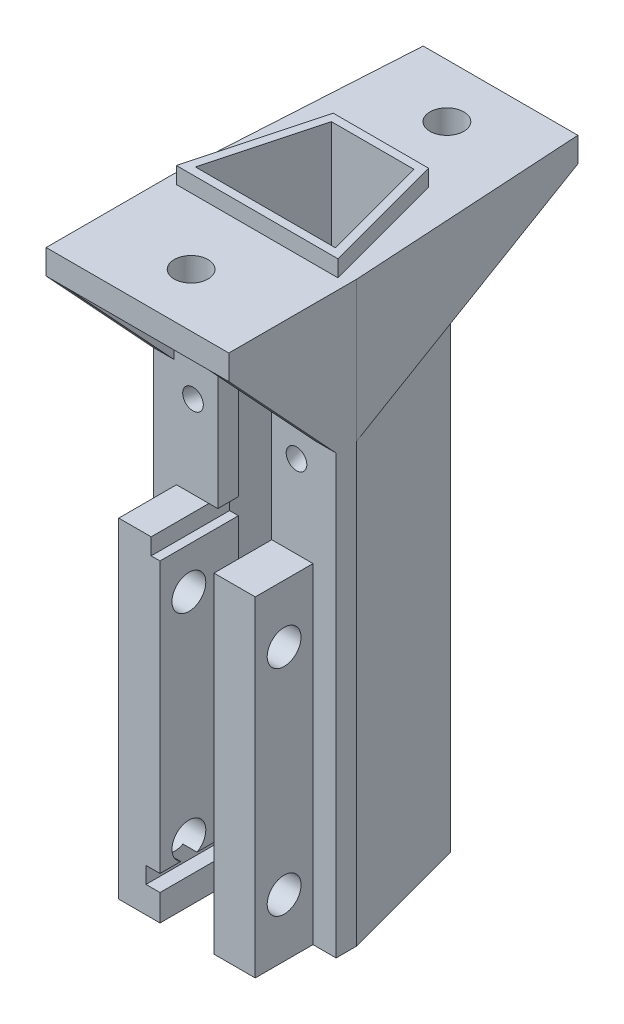
from build123d import *

# Parameters (mm, degrees)
BOSS_EXTRUDE1_DEPTH      = 40
SKETCH3_R                = 2.05
CUT_EXTRUDE2_DEPTH       = 40
BOSS_EXTRUDE2_DEPTH      = 30
SKETCH7_W                = 4.5
SKETCH7_H                = 2
CUT_EXTRUDE3_DEPTH       = 76.328383431
SKETCH8_W                = 1.7
SKETCH8_H                = 2
CUT_EXTRUDE4_DEPTH       = 73.729741855
BOSS_EXTRUDE3_DEPTH      = 2
SKETCH10_W               = 4.5
SKETCH10_H               = 75
CUT_EXTRUDE5_DEPTH       = 1.5
SKETCH13_W               = 2.8
SKETCH13_H               = 2
CUT_EXTRUDE7_DEPTH       = 1.5
SKETCH15_W               = 1.5
SKETCH15_H               = 2
CUT_EXTRUDE8_DEPTH       = 18.5
SKETCH16_R               = 1.25
CUT_EXTRUDE9_DEPTH       = 3.5
SKETCH17_R               = 1.25
CUT_EXTRUDE10_DEPTH      = 3.5
SKETCH18_W               = 22.143059906
SKETCH18_H               = 3
BOSS_EXTRUDE4_DEPTH      = 15.5
BOSS_EXTRUDE5_DEPTH      = 13
BOSS_EXTRUDE5_DEPTH_BACK = 2
SKETCH19_W               = 13.83663494
SKETCH19_H               = 3
BOSS_EXTRUDE6_DEPTH      = 2.5
BOSS_EXTRUDE8_DEPTH      = 2.5
BOSS_EXTRUDE9_DEPTH      = 4.2
BOSS_EXTRUDE10_DEPTH     = 4.2
SKETCH25_R               = 2.05
CUT_EXTRUDE12_DEPTH      = 3.5
CUT_EXTRUDE13_DEPTH      = 71.528016285
CUT_EXTRUDE14_DEPTH      = 71.528016285


with BuildPart() as part:
    # Sketch2 → Boss-Extrude1 (new body)
    with BuildSketch(Plane(origin=(0, 0, 0), x_dir=(1, 0, 0), z_dir=(0, 1, 0))):
        Polygon((5.768335638, 3.843580014), (-8.068299302, 3.843580014), (-12.221511785, -11.656419986), (-12.221511785, -14.156419986), (-9.421511785, -14.156419986), (-9.421511785, -21.156419986), (-4.421511785, -21.156419986), (-4.421511785, -11.656419986), (-9.633321334, -11.656419986), (-6.149981832, 1.343580014), (3.850018168, 1.343580014), (7.33335767, -11.656419986), (2.121548121, -11.656419986), (2.121548121, -21.156419986), (7.121548121, -21.156419986), (7.121548121, -14.156419986), (9.921548121, -14.156419986), (9.921548121, -11.656419986), align=None)
    extrude(amount=BOSS_EXTRUDE1_DEPTH)

    # Sketch3 → Cut-Extrude2 (cut)
    with BuildSketch(Plane.ZY.offset(9.421511785)):
        with Locations((17.656419986, 33)):
            Circle(SKETCH3_R)
        with Locations((17.656419986, 7)):
            Circle(SKETCH3_R)
    extrude(amount=-CUT_EXTRUDE2_DEPTH, mode=Mode.SUBTRACT)

    # Sketch4 → Boss-Extrude2 (add)
    with BuildSketch(Plane(origin=(0, 40, 0), x_dir=(1, 0, 0), z_dir=(0, 1, 0))):
        Polygon((-4.421511785, -11.656419986), (-9.633321334, -11.656419986), (-6.149981832, 1.343580014), (3.850018168, 1.343580014), (7.33335767, -11.656419986), (2.121548121, -11.656419986), (2.121548121, -14.156419986), (7.121548121, -14.156419986), (9.921548121, -14.156419986), (9.921548121, -11.656419986), (5.768335638, 3.843580014), (-8.068299302, 3.843580014), (-12.221511785, -11.656419986), (-12.221511785, -14.156419986), (-9.421511785, -14.156419986), (-4.421511785, -14.156419986), align=None)
    extrude(amount=BOSS_EXTRUDE2_DEPTH)

    # Sketch7 → Cut-Extrude3 (cut, through all)
    with BuildSketch(Plane(origin=(0, 0, -3.843580014), x_dir=(-1, 0, 0), z_dir=(0, 0, -1))):
        with Locations((3.241664362, 39)):
            Rectangle(SKETCH7_W, SKETCH7_H)
    extrude(amount=-CUT_EXTRUDE3_DEPTH, mode=Mode.SUBTRACT)

    # Sketch8 → Cut-Extrude4 (cut, through all)
    with BuildSketch(Plane(origin=(0, 0, 11.656419986), x_dir=(-1, 0, 0), z_dir=(0, 0, -1))):
        with Locations((5.271511785, 4.2)):
            Rectangle(SKETCH8_W, SKETCH8_H)
    extrude(amount=-CUT_EXTRUDE4_DEPTH, mode=Mode.SUBTRACT)

    # Sketch9 → Boss-Extrude3 (add)
    with BuildSketch(Plane(origin=(0, 70, 0), x_dir=(1, 0, 0), z_dir=(0, 1, 0))):
        Polygon((-10.936546706, -12.656419986), (8.636583042, -12.656419986), (4.617345156, 2.343580014), (-6.91730882, 2.343580014), align=None)
        Polygon((7.33335767, -11.656419986), (-9.633321334, -11.656419986), (-6.149981832, 1.343580014), (3.850018168, 1.343580014), align=None, mode=Mode.SUBTRACT)
    extrude(amount=BOSS_EXTRUDE3_DEPTH)

    # Sketch10 → Cut-Extrude5 (cut)
    with BuildSketch(Plane(origin=(0, 0, -3.843580014), x_dir=(-1, 0, 0), z_dir=(0, 0, -1))):
        with Locations((3.241664362, 77.5)):
            Rectangle(SKETCH10_W, SKETCH10_H)
    extrude(amount=-CUT_EXTRUDE5_DEPTH, mode=Mode.SUBTRACT)

    # Sketch13 → Cut-Extrude7 (cut)
    with BuildSketch(Plane(origin=(0, 0, -2.343580014), x_dir=(-1, 0, 0), z_dir=(0, 0, -1))):
        with Locations((6.891664362, 41)):
            Rectangle(SKETCH13_W, SKETCH13_H)
    extrude(amount=CUT_EXTRUDE7_DEPTH, mode=Mode.SUBTRACT)

    # Sketch15 → Cut-Extrude8 (cut, along a direction that is not the sketch's normal)
    with BuildSketch(Plane(origin=(0, 0, -3.843580014), x_dir=(-1, 0, 0), z_dir=(0, 0, -1))):
        with Locations((7.318299302, 41)):
            Rectangle(SKETCH15_W, SKETCH15_H)
    extrude(amount=-CUT_EXTRUDE8_DEPTH, dir=(0.25881904510252474, 0, -0.9659258262890672), mode=Mode.SUBTRACT)

    # Sketch16 → Cut-Extrude9 (cut, along a direction that is not the sketch's normal)
    with BuildSketch(Plane.XY.offset(14.156419986)):
        with Locations((-7.421511785, 50)):
            Circle(SKETCH16_R)
    extrude(amount=-CUT_EXTRUDE9_DEPTH, dir=(-0.2588190451025246, 0, 0.9659258262890672), mode=Mode.SUBTRACT)

    # Sketch17 → Cut-Extrude10 (cut, along a direction that is not the sketch's normal)
    with BuildSketch(Plane.XY.offset(14.156419986)):
        with Locations((5.121548121, 50)):
            Circle(SKETCH17_R)
    extrude(amount=-CUT_EXTRUDE10_DEPTH, dir=(0.25881904510251796, 0, 0.9659258262890691), mode=Mode.SUBTRACT)

    # Sketch18 → Boss-Extrude4 (add)
    with BuildSketch(Plane(origin=(0, 0, 11.656419986), x_dir=(-1, 0, 0), z_dir=(0, 0, -1))):
        with Locations((1.149981832, 68.5)):
            Rectangle(SKETCH18_W, SKETCH18_H)
    extrude(amount=-BOSS_EXTRUDE4_DEPTH)

    # Sketch19 → Boss-Extrude5 (add, two sides: drawn at the far end of the back side and taken through both)
    with BuildSketch(Plane(origin=(0, 0, -3.843580014), x_dir=(-1, 0, 0), z_dir=(0, 0, -1)).offset(-BOSS_EXTRUDE5_DEPTH_BACK)):
        with Locations((1.149981832, 68.5)):
            Rectangle(SKETCH19_W, SKETCH19_H)
    extrude(amount=BOSS_EXTRUDE5_DEPTH + BOSS_EXTRUDE5_DEPTH_BACK)

    # Sketch21 → Boss-Extrude6 (add)
    with BuildSketch(Plane.ZY.offset(12.221511785)):
        Polygon((27.156419986, 67), (14.156419986, 53), (14.156419986, 67), align=None)
    extrude(amount=-BOSS_EXTRUDE6_DEPTH)

    # Sketch22 → Boss-Extrude8 (add)
    with BuildSketch(Plane(origin=(9.921548121, 0, 0), x_dir=(0, 0, -1), z_dir=(1, 0, 0))):
        Polygon((-27.156419986, 67), (-14.156419986, 67), (-14.156419986, 53), align=None)
    extrude(amount=-BOSS_EXTRUDE8_DEPTH)

    # Sketch23 → Boss-Extrude9 (add)
    with BuildSketch(Plane(origin=(9.921548121, 0, 0), x_dir=(0, 0, -1), z_dir=(1, 0, 0))):
        Polygon((-11.656419986, 70), (-11.656419986, 53), (16.843580014, 67), (16.843580014, 70), align=None)
    extrude(amount=-BOSS_EXTRUDE9_DEPTH)

    # Sketch24 → Boss-Extrude10 (add)
    with BuildSketch(Plane.ZY.offset(12.221511785)):
        Polygon((11.656419986, 70), (-16.843580014, 70), (-16.843580014, 67), (11.656419986, 53), align=None)
    extrude(amount=-BOSS_EXTRUDE10_DEPTH)

    # Sketch25 → Cut-Extrude12 (cut)
    with BuildSketch(Plane(origin=(0, 70, 0), x_dir=(1, 0, 0), z_dir=(0, 1, 0))):
        with Locations((-1.149981694, 10.343580014)):
            Circle(SKETCH25_R)
        with Locations((-1.149981723, -20.656419986)):
            Circle(SKETCH25_R)
    extrude(amount=-CUT_EXTRUDE12_DEPTH, mode=Mode.SUBTRACT)

    # Sketch26 → Cut-Extrude13 (cut, through all, along a direction that is not the sketch's normal)
    with BuildSketch(Plane(origin=(0, 47.309855268, 23.239928904), x_dir=(-1, 0, 0), z_dir=(-4.742047126241555e-14, -0.8975543264374147, -0.4409038796534669))):
        Polygon((-5.721548121, 12.905635433), (-7.33335767, 12.905635433), (-5.721548121, 19.607575306), align=None)
        Polygon((8.021511785, 12.905635433), (8.021511785, 19.607575306), (9.633321334, 12.905635433), align=None)
    extrude(amount=-CUT_EXTRUDE13_DEPTH, dir=(0, -1, 0), mode=Mode.SUBTRACT)

    # Sketch27 → Cut-Extrude14 (cut, through all, along a direction that is not the sketch's normal)
    with BuildSketch(Plane(origin=(0, 47.309855268, 23.239928904), x_dir=(-1, 0, 0), z_dir=(0, -0.8975543264374147, -0.440903879653467))):
        Polygon((12.221511785, 12.905635433), (10.521511785, 44.658588051), (12.221511785, 44.658588051), align=None)
        Polygon((-9.921548121, 12.905635433), (-9.921548121, 44.658588051), (-8.221548121, 44.658588051), align=None)
    extrude(amount=-CUT_EXTRUDE14_DEPTH, dir=(0, -1, 0), mode=Mode.SUBTRACT)


solid = part.part
